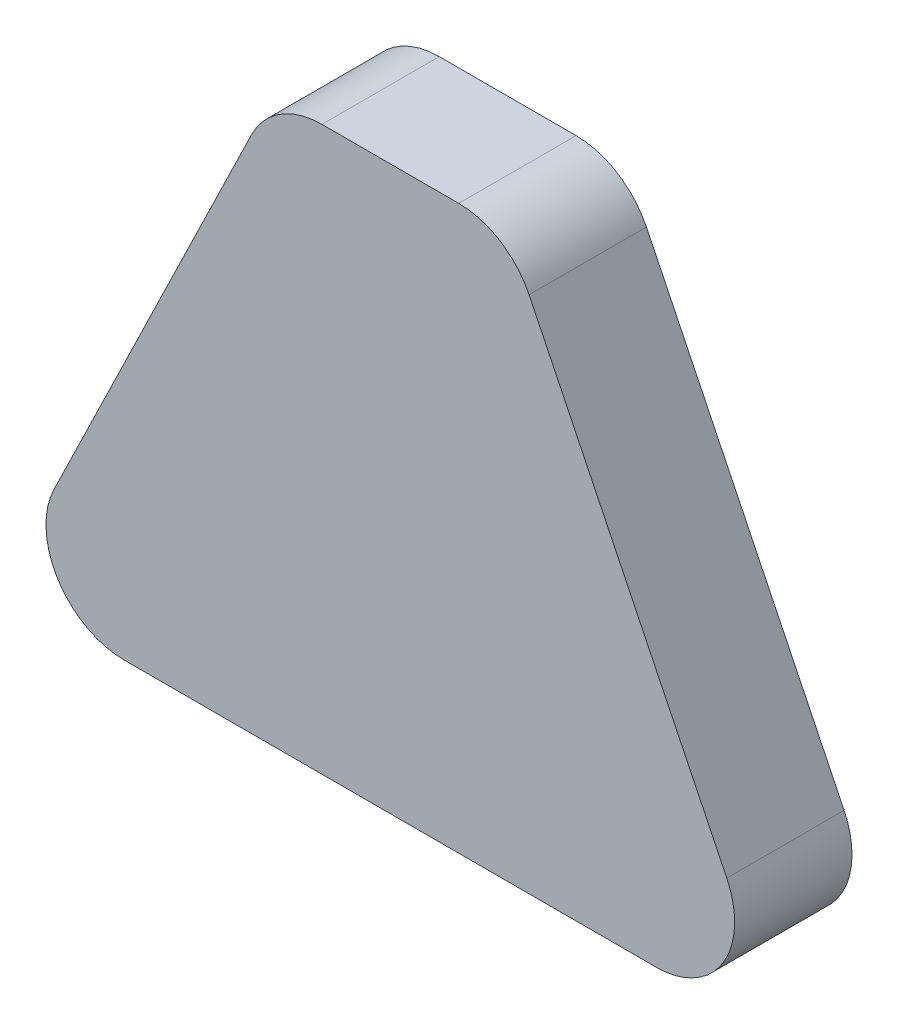
from build123d import *

# Parameters (mm, degrees)
BOSS_EXTRUDE1_DEPTH = 15
FILLET1_R           = 10


with BuildPart() as part:
    # Sketch1 → Boss-Extrude1 (new body)
    with BuildSketch(Plane.XY):
        Polygon((-50, 0), (-15, 71.93747285), (15, 71.93747285), (50, 0), align=None)
    extrude(amount=BOSS_EXTRUDE1_DEPTH)

    # Fillet1
    fillet1_edges = [part.edges().sort_by_distance(p)[0] for p in [
        (-50, 0, 7.5),
        (50, 0, 7.5),
        (15, 71.93747285, 7.5),
        (-15, 71.93747285, 7.5),
    ]]
    fillet(fillet1_edges, radius=FILLET1_R)


solid = part.part
